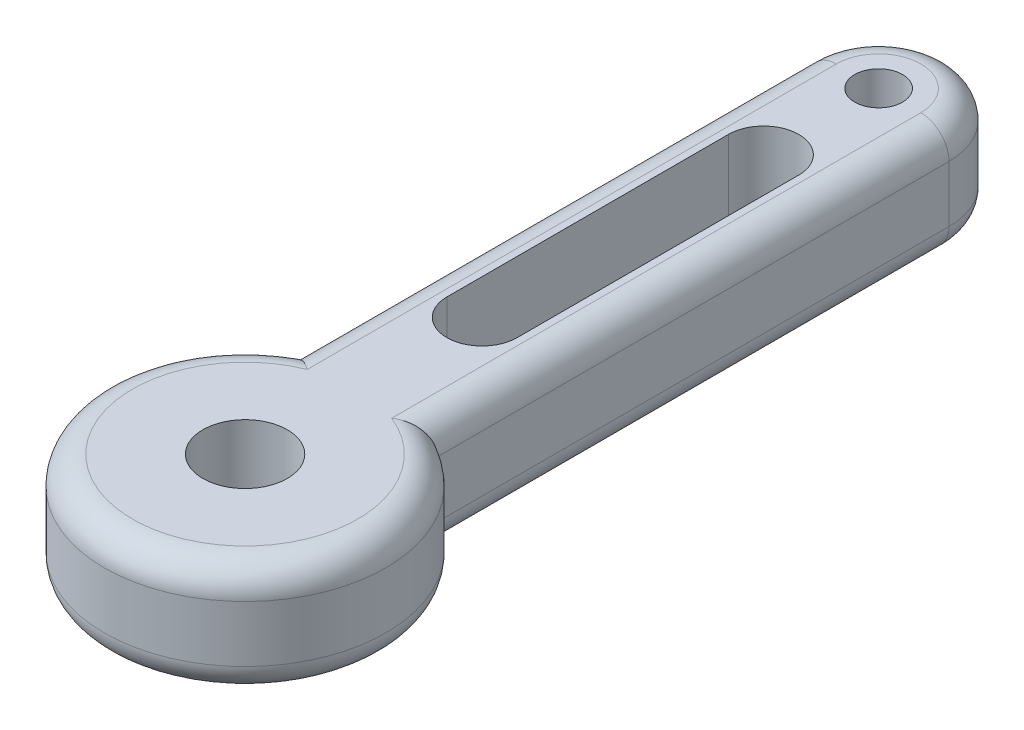
from build123d import *

# Parameters (mm, degrees)
EXTRUDE_1_DEPTH     = 8
CUT_EXTRUDE_1_REACH = 53.614
CUT_EXTRUDE_START   = -3
CUT_EXTRUDE_2_DEPTH = 3
CUT_EXTRUDE_3_REACH = 53.614
CUT_EXTRUDE_4_REACH = 53.614
FILLET_2_R          = 2


with BuildPart() as part:
    # 草图1 → 凸台-拉伸1 (new body)
    with BuildSketch(Plane(origin=(0, 0, 0), x_dir=(1, 0, 0), z_dir=(0, 1, 0))):
        with BuildLine():
            Line((-5, 45), (-5, 8.660254038))
            ThreePointArc((-5, 8.660254038), (0, -10), (5, 8.660254038))
            Line((5, 8.660254038), (5, 45))
            ThreePointArc((5, 45), (0, 50), (-5, 45))
        make_face()
    extrude(amount=EXTRUDE_1_DEPTH)

    # 草图2 → 切除-拉伸1 (cut, up to next)
    with BuildSketch(Plane(origin=(0, 8, 0), x_dir=(1, 0, 0), z_dir=(0, 1, 0)), mode=Mode.PRIVATE) as cut_extrude_1_sk1:
        with BuildLine():
            ThreePointArc((3, 0), (2.121320344, 2.121320344), (0, 3))
            ThreePointArc((0, 3), (-2.121320344, -2.121320344), (3, 0))
        make_face()
    cut_extrude_1_tool1 = extrude(cut_extrude_1_sk1.sketch, amount=-CUT_EXTRUDE_1_REACH, mode=Mode.PRIVATE) & part.part
    add(cut_extrude_1_tool1.solids().sort_by_distance((0, 8, 0))[0], mode=Mode.SUBTRACT)

    # 草图3 → 切除-拉伸2 (cut)
    with BuildSketch(Plane.XZ.offset(CUT_EXTRUDE_START)):
        with BuildLine():
            Line((-2.984962311, -0.3), (-1.989974874, -10.2))
            ThreePointArc((-1.989974874, -10.2), (-0.218979353, -11.987975866), (1.898730713, -10.628348376))
            Line((1.898730713, -10.628348376), (2.984962311, -0.3))
            ThreePointArc((2.984962311, -0.3), (0, 3), (-2.984962311, -0.3))
        make_face()
    extrude(amount=CUT_EXTRUDE_2_DEPTH, mode=Mode.SUBTRACT)

    # 草图4 → 切除-拉伸3 (cut, up to next)
    with BuildSketch(Plane(origin=(0, 8, 0), x_dir=(1, 0, 0), z_dir=(0, 1, 0)), mode=Mode.PRIVATE) as cut_extrude_3_sk1:
        with BuildLine():
            ThreePointArc((1.7, 45), (-1.202081528, 46.202081528), (0, 43.3))
            ThreePointArc((0, 43.3), (1.202081528, 43.797918472), (1.7, 45))
        make_face()
    cut_extrude_3_tool1 = extrude(cut_extrude_3_sk1.sketch, amount=-CUT_EXTRUDE_3_REACH, mode=Mode.PRIVATE) & part.part
    add(cut_extrude_3_tool1.solids().sort_by_distance((0, 8, -45))[0], mode=Mode.SUBTRACT)

    # 草图5 → 切除-拉伸4 (cut, up to next)
    with BuildSketch(Plane.XZ, mode=Mode.PRIVATE) as cut_extrude_4_sk1:
        with BuildLine():
            Line((-2.5, -16.830127019), (-2.5, -26.830127019))
            Line((-2.5, -26.830127019), (-2.5, -36.830127019))
            ThreePointArc((-2.5, -36.830127019), (0, -39.330127019), (2.5, -36.830127019))
            Line((2.5, -36.830127019), (2.5, -16.830127019))
            ThreePointArc((2.5, -16.830127019), (0, -14.330127019), (-2.5, -16.830127019))
        make_face()
    cut_extrude_4_tool1 = extrude(cut_extrude_4_sk1.sketch, amount=-CUT_EXTRUDE_4_REACH, mode=Mode.PRIVATE) & part.part
    add(cut_extrude_4_tool1.solids().sort_by_distance((0, 0, -26.830127))[0], mode=Mode.SUBTRACT)

    # 圆角2
    fillet_2_edges = [part.edges().sort_by_distance(p)[0] for p in [
        (0, 0, 10),
        (-5, 0, -26.830127019),
        (0, 0, -50),
        (5, 0, -26.830127019),
        (0, 8, 10),
        (5, 8, -26.830127019),
        (0, 8, -50),
        (-5, 8, -26.830127019),
    ]]
    fillet(fillet_2_edges, radius=FILLET_2_R)


solid = part.part
